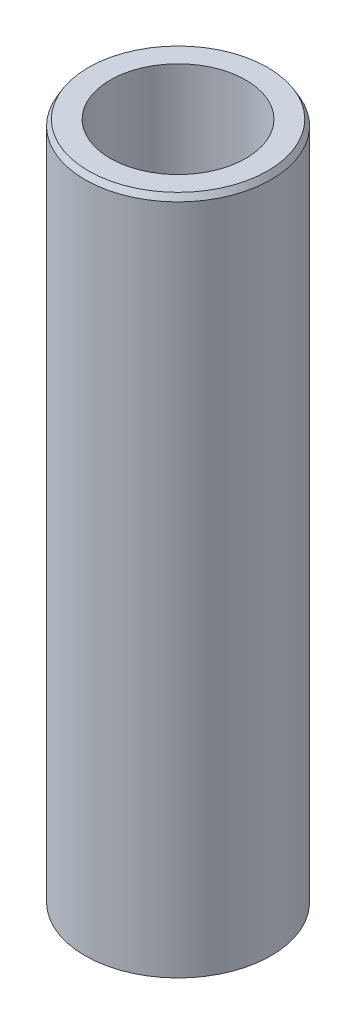
from build123d import *
from OCP.BRepFilletAPI import BRepFilletAPI_MakeChamfer

# Parameters (mm, degrees)
SKETCH1_R           = 12.5
BOSS_EXTRUDE1_DEPTH = 91.557581165
SKETCH2_R           = 9.119818262
CUT_EXTRUDE1_DEPTH  = 94.248542448
CHAMFER1_SIZE       = 0.790870547
CHAMFER1_SIZE2      = 0.456609323


with BuildPart() as part:
    # Sketch1 → Boss-Extrude1 (new body)
    with BuildSketch(Plane(origin=(0, 0, 0), x_dir=(1, 0, 0), z_dir=(0, 1, 0))):
        Circle(SKETCH1_R)
    extrude(amount=BOSS_EXTRUDE1_DEPTH)

    # Sketch2 → Cut-Extrude1 (cut, through all)
    with BuildSketch(Plane(origin=(0, 0, 0), x_dir=(1, 0, 0), z_dir=(0, 1, 0))):
        Circle(SKETCH2_R)
    extrude(amount=CUT_EXTRUDE1_DEPTH, mode=Mode.SUBTRACT)

    # Chamfer1: one chamfer whose edges measure the first distance from different faces: ONE call of the kernel's chamfer builder (chamfer() names one face for all edges)
    chamfer1_edges_1 = [part.edges().sort_by_distance(p)[0] for p in [
        (-12.5, 91.557581165, 0),
    ]]
    chamfer1_side_1 = [part.faces().sort_by_distance(p)[0] for p in [
        (-12.5, 45.778790582, 0),
    ]]
    chamfer1_edges_2 = [part.edges().sort_by_distance(p)[0] for p in [
        (-12.5, 0, 0),
    ]]
    chamfer1_side_2 = [part.faces().sort_by_distance(p)[0] for p in [
        (-12.146446609, 0, 0),
    ]]
    chamfer1 = BRepFilletAPI_MakeChamfer(part.part.solid().wrapped)
    for e in chamfer1_edges_1:
        chamfer1.Add(CHAMFER1_SIZE, CHAMFER1_SIZE2, e.wrapped, chamfer1_side_1[0].wrapped)  # the first distance lies on this face
    for e in chamfer1_edges_2:
        chamfer1.Add(CHAMFER1_SIZE, CHAMFER1_SIZE2, e.wrapped, chamfer1_side_2[0].wrapped)  # the first distance lies on this face
    add(Compound.cast(chamfer1.Shape()), mode=Mode.REPLACE)


solid = part.part
